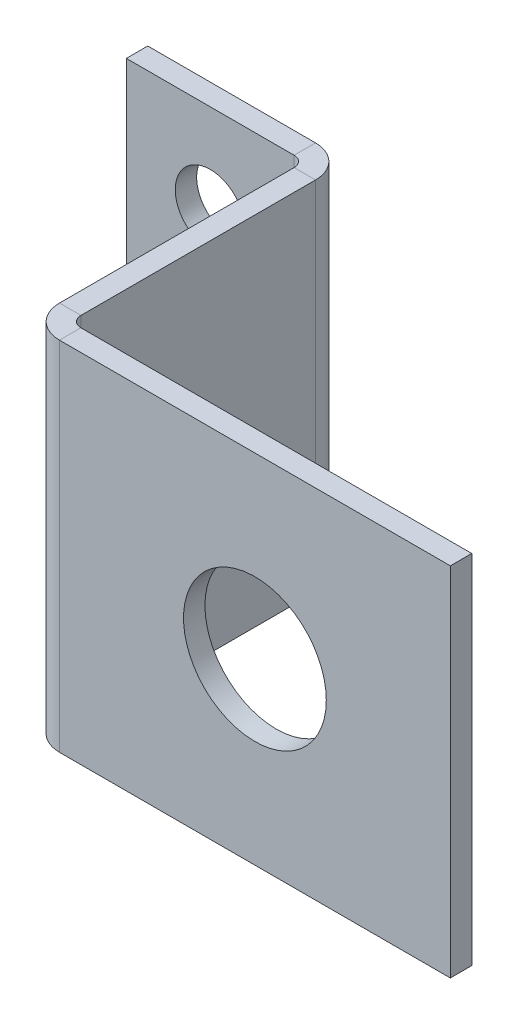
from build123d import *

# Parameters (mm, degrees)
SKETCH5_W                    = 12.7
SKETCH5_H                    = 25.4
BASE_FLANGE1_DEPTH           = 1.524
EDGE_FLANGE1_STRIP_W         = 7.62
EDGE_FLANGE1_STRIP_H         = 1.524
EDGE_FLANGE1_STRIP_CUT_DEPTH = 25.4
EDGE_FLANGE1_DEPTH           = 25.4
EDGE_FLANGE2_STRIP_W         = 7.62
EDGE_FLANGE2_STRIP_H         = 1.524
EDGE_FLANGE2_STRIP_CUT_DEPTH = 25.4
EDGE_FLANGE2_DEPTH           = 25.4
CUT_EXTRUDE1_REACH           = 56.123
SKETCH16_R                   = 5.08
F_10_CLEARANCE_HOLE2_D       = 4.9784


# Sheet-metal steps are written as plain solids
with BuildPart() as part:
    # Sketch5 → Base-Flange1 (new body)
    with BuildSketch(Plane.XY):
        with Locations((6.35, 12.7)):
            Rectangle(SKETCH5_W, SKETCH5_H)
    extrude(amount=-BASE_FLANGE1_DEPTH)

    # Edge-Flange1 strip (across the edge) → Edge-Flange1 strip cut (cut)
    with BuildSketch(Plane(origin=(12.7, 0, 0), x_dir=(-1, 0, 0), z_dir=(0, 1, 0))):
        with Locations((-3.048, -0.762)):
            Rectangle(EDGE_FLANGE1_STRIP_W, EDGE_FLANGE1_STRIP_H)
    extrude(amount=EDGE_FLANGE1_STRIP_CUT_DEPTH, mode=Mode.SUBTRACT)

    # Edge-Flange1 section (across the edge) → Edge-Flange1 (add)
    with BuildSketch(Plane(origin=(12.7, 0, 0), x_dir=(-1, 0, 0), z_dir=(0, 1, 0))):
        with BuildLine():
            Line((-1.524, 0.762), (-1.524, 18.22041314))
            Line((-1.524, 18.22041314), (0, 18.22041314))
            Line((0, 18.22041314), (0, 0.762))
            ThreePointArc((0, 0.762), (0.223184633, 0.223184633), (0.762, 0))
            Line((0.762, 0), (0.762, -1.524))
            ThreePointArc((0.762, -1.524), (-0.854446102, -0.854446102), (-1.524, 0.762))
        make_face()
    extrude(amount=EDGE_FLANGE1_DEPTH)

    # Edge-Flange2 strip (across the edge) → Edge-Flange2 strip cut (cut)
    with BuildSketch(Plane(origin=(14.224, 25.4, 18.22041314), x_dir=(0, 0, -1), z_dir=(0, -1, 0))):
        with Locations((-3.048, -0.762)):
            Rectangle(EDGE_FLANGE2_STRIP_W, EDGE_FLANGE2_STRIP_H)
    extrude(amount=EDGE_FLANGE2_STRIP_CUT_DEPTH, mode=Mode.SUBTRACT)

    # Edge-Flange2 section (across the edge) → Edge-Flange2 (add)
    with BuildSketch(Plane(origin=(14.224, 25.4, 18.22041314), x_dir=(0, 0, -1), z_dir=(0, -1, 0))):
        with BuildLine():
            Line((-1.524, 0.762), (-1.524, 28.575))
            Line((-1.524, 28.575), (0, 28.575))
            Line((0, 28.575), (0, 0.762))
            ThreePointArc((0, 0.762), (0.223184633, 0.223184633), (0.762, 0))
            Line((0.762, 0), (0.762, -1.524))
            ThreePointArc((0.762, -1.524), (-0.854446102, -0.854446102), (-1.524, 0.762))
        make_face()
    extrude(amount=EDGE_FLANGE2_DEPTH)

    # Sketch16 → Cut-Extrude1 (cut, up to next)
    with BuildSketch(Plane.XY.offset(19.74441314), mode=Mode.PRIVATE) as cut_extrude1_sk1:
        with Locations((28.8925, 12.7)):
            Circle(SKETCH16_R)
    cut_extrude1_tool1 = extrude(cut_extrude1_sk1.sketch, amount=-CUT_EXTRUDE1_REACH, mode=Mode.PRIVATE) & part.part
    add(cut_extrude1_tool1.solids().sort_by_distance((28.8925, 12.7, 19.744413))[0], mode=Mode.SUBTRACT)

    # #10 Clearance Hole2 (through all)
    with Locations(Plane.XY):
        with Locations((5.969, 19.05), (5.969, 6.35)):
            Hole(F_10_CLEARANCE_HOLE2_D / 2)


solid = part.part
